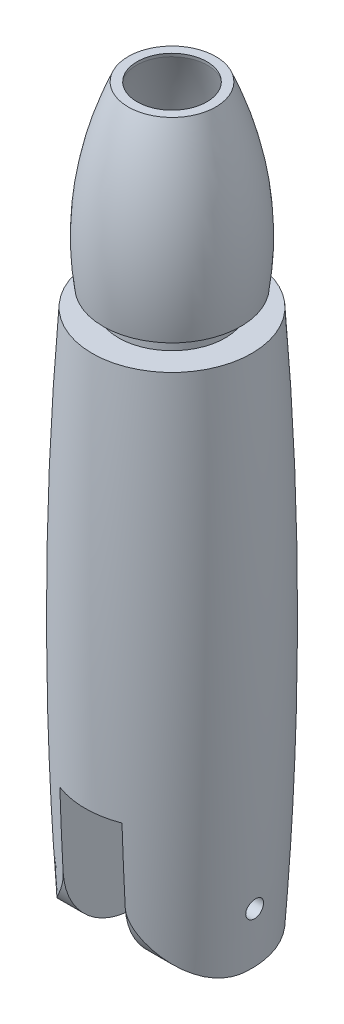
from build123d import *

# Parameters (mm, degrees)
CUT_EXTRUDE1_DEPTH      = 85.764379442
CUT_EXTRUDE1_DEPTH_BACK = 7.5
SKETCH2_W               = 7
SKETCH2_H               = 16
CUT_EXTRUDE2_DEPTH      = 85.764379442
CUT_EXTRUDE2_DEPTH_BACK = 85.764379442
SKETCH3_R               = 1
CUT_EXTRUDE4_REACH      = 76.985
SKETCH5_R               = 1
SKETCH5_R_2             = 0.75
SKETCH6_W               = 7
SKETCH6_H               = 6
CUT_EXTRUDE5_DEPTH      = 86.972379423


with BuildPart() as part:
    # Sketch1 → Revolve1 (revolve)
    with BuildSketch(Plane.XY):
        with BuildLine():
            Line((3, 60), (0, 60))
            ThreePointArc((0, 60), (-1, 30), (0, 0))
            Line((0, 0), (3, 0))
            Line((3, 0), (9, 0))
            Line((9, 0), (9, 14))
            Line((9, 14), (9, 26))
            Line((9, 26), (9, 60))
            Line((9, 60), (9, 71.845749874))
            Line((9, 71.845749874), (2.237118871, 71.845749874))
            add(Edge.make_bspline(
                [(4.990117088, 81.608356612), (4.650560747, 80.810611516), (4.014791389, 79.180712417), (3.110824263, 76.339058983), (2.550981979, 73.890897473), (2.293586976, 72.251014058), (2.237118871, 71.845749874)],
                knots=[0, 0, 0, 0, 0.125, 0.25, 0.440447326, 0.502947326, 0.502947326, 0.502947326, 0.502947326], degree=3))
            Line((4.990117088, 81.608356612), (5.07, 82))
            Line((5.07, 82), (4.07, 82))
            add(Edge.make_bspline(
                [(4.07, 82), (-0.150100512, 72.085402408), (1.25, 62)],
                knots=[0, 0, 0, 1, 1, 1], degree=2))
            Line((1.25, 62), (3, 62))
            Line((3, 62), (3, 60))
        make_face()
    revolve(axis=Axis((9, 26, 0), (0, -1, 0)))

    # Sketch2 → Cut-Extrude1 (cut, two sides: drawn at the far end of the back side and taken through both)
    with BuildSketch(Plane.XY.offset(-CUT_EXTRUDE1_DEPTH_BACK)):
        with Locations((9, 8)):
            Rectangle(SKETCH2_W, SKETCH2_H)
    extrude(amount=CUT_EXTRUDE1_DEPTH + CUT_EXTRUDE1_DEPTH_BACK, mode=Mode.SUBTRACT)

    # Sketch3 → Cut-Extrude2 (cut, two sides: drawn at the far end of the back side and taken through both)
    with BuildSketch(Plane(origin=(0, 0, 0), x_dir=(0, 0, -1), z_dir=(1, 0, 0)).offset(-CUT_EXTRUDE2_DEPTH_BACK)):
        with BuildLine():
            add(Edge.make_bspline(
                [(-8.291561976, 0), (-8.387241949, 1.320758234), (-8.476359043, 2.64194982), (-8.600349068, 4.624376749), (-8.659921887, 5.615750152), (-8.715884867, 6.607361916), (-8.745670836, 7.14674895), (-8.757214955, 7.358763953), (-8.768618221, 7.571211202)],
                knots=[0, 0, 0, 0, 0.25, 0.25, 0.375, 0.4375, 0.4375, 0.476982441, 0.476982441, 0.476982441, 0.476982441], degree=3))
            Line((-8.291561976, 0), (-0.780117726, 0))
            ThreePointArc((-0.780117726, 0), (-6.283284524, 2.193524719), (-8.768618221, 7.571211202))
        make_face()
        with Locations((0, 6)):
            Circle(SKETCH3_R)
    extrude(amount=CUT_EXTRUDE2_DEPTH + CUT_EXTRUDE2_DEPTH_BACK, mode=Mode.SUBTRACT)

    # Sketch5 → Cut-Extrude4 (cut, up to next)
    with BuildSketch(Plane(origin=(0, 71.845749874, 0), x_dir=(1, 0, 0), z_dir=(0, 1, 0)), mode=Mode.PRIVATE) as cut_extrude4_sk1:
        with Locations((9, 4)):
            Circle(SKETCH5_R)
    cut_extrude4_tool1 = extrude(cut_extrude4_sk1.sketch, amount=-CUT_EXTRUDE4_REACH, mode=Mode.PRIVATE) & part.part
    # Sketch5 → Cut-Extrude4 (cut, up to next)
    with BuildSketch(Plane(origin=(0, 71.845749874, 0), x_dir=(1, 0, 0), z_dir=(0, 1, 0)), mode=Mode.PRIVATE) as cut_extrude4_sk2:
        with Locations((9, -3)):
            Circle(SKETCH5_R_2)
    cut_extrude4_tool2 = extrude(cut_extrude4_sk2.sketch, amount=-CUT_EXTRUDE4_REACH, mode=Mode.PRIVATE) & part.part
    add(cut_extrude4_tool1.solids().sort_by_distance((9, 71.84575, -4))[0], mode=Mode.SUBTRACT)
    add(cut_extrude4_tool2.solids().sort_by_distance((9, 71.84575, 3))[0], mode=Mode.SUBTRACT)

    # Sketch6 → Cut-Extrude5 (cut, through all)
    with BuildSketch(Plane.XY.offset(-7.5)):
        with Locations((9, 3)):
            Rectangle(SKETCH6_W, SKETCH6_H)
    extrude(amount=-CUT_EXTRUDE5_DEPTH, mode=Mode.SUBTRACT)


solid = part.part
